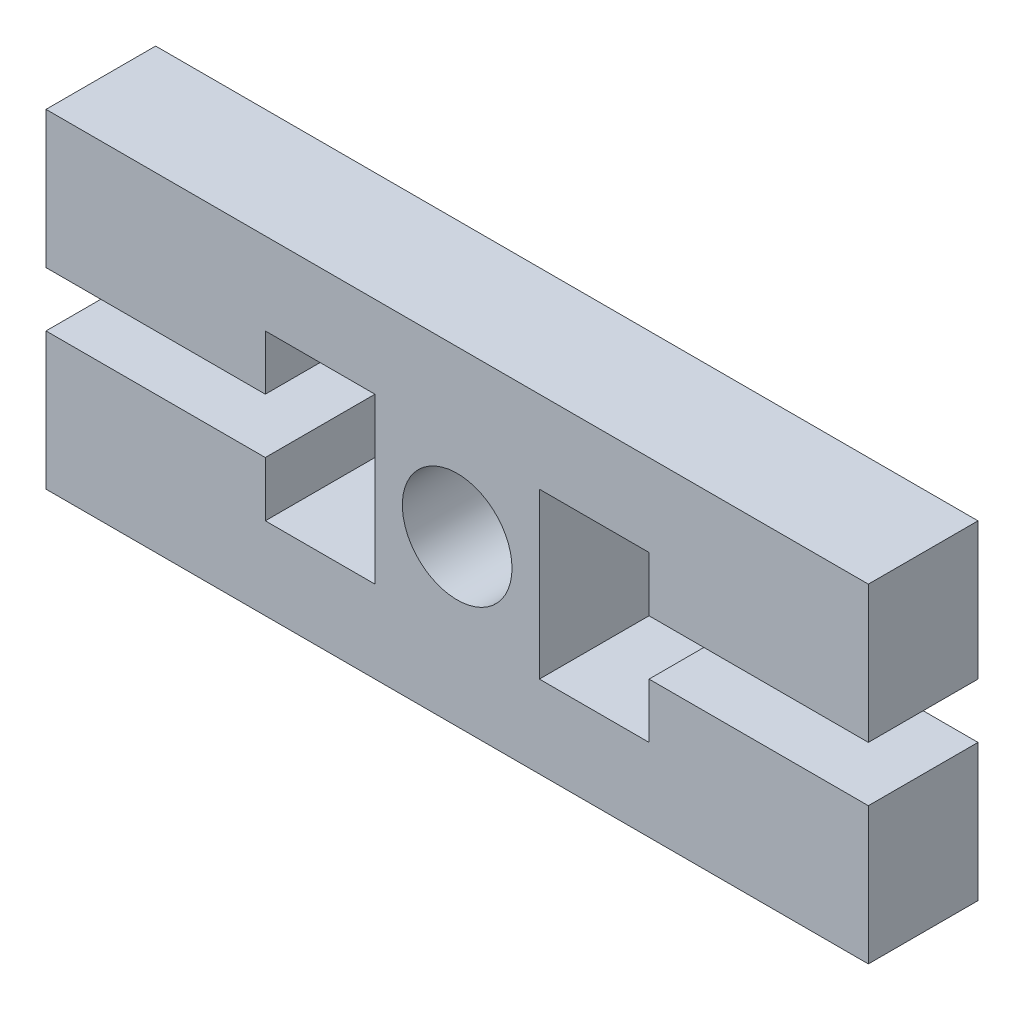
from build123d import *

# Parameters (mm, degrees)
SKETCH1_R           = 12.7
BOSS_EXTRUDE1_DEPTH = 25.4


with BuildPart() as part:
    # Sketch1 → Boss-Extrude1 (new body)
    with BuildSketch(Plane.XY):
        Polygon((-95.25, 38.1), (95.25, 38.1), (95.25, 6.35), (44.45, 6.35), (44.45, 19.05), (19.05, 19.05), (19.05, -19.05), (44.45, -19.05), (44.45, -6.35), (95.25, -6.35), (95.25, -38.1), (-95.25, -38.1), (-95.25, -6.35), (-44.45, -6.35), (-44.45, -19.05), (-19.05, -19.05), (-19.05, 19.05), (-44.45, 19.05), (-44.45, 6.35), (-95.25, 6.35), align=None)
        Circle(SKETCH1_R, mode=Mode.SUBTRACT)
    extrude(amount=BOSS_EXTRUDE1_DEPTH)


solid = part.part
